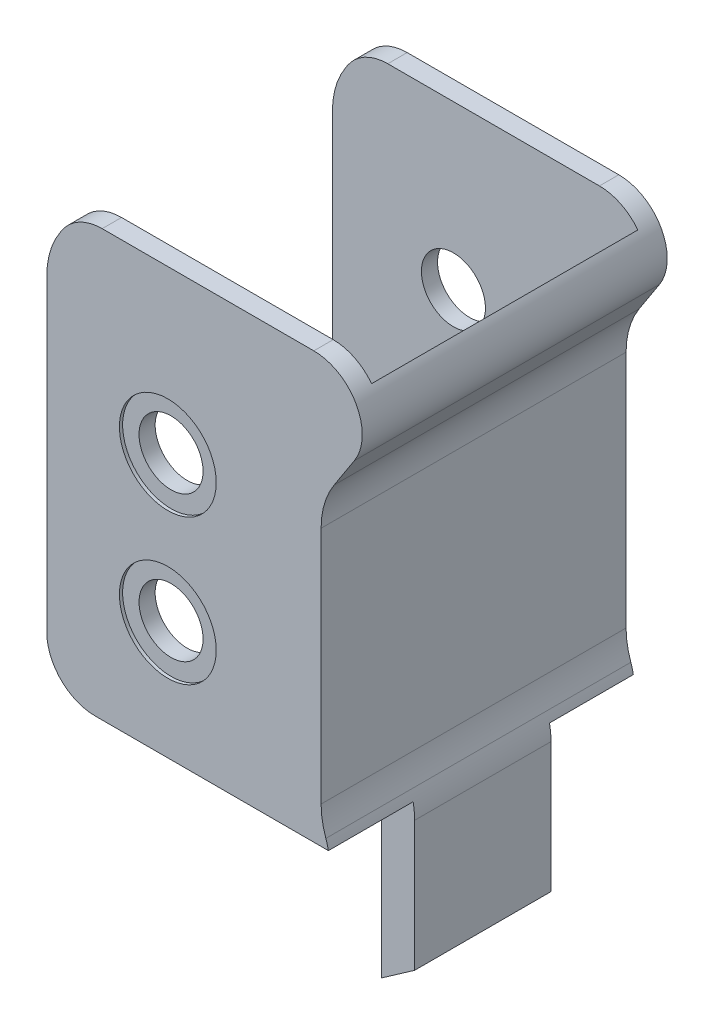
from build123d import *

# Parameters (mm, degrees)
BOSS_EXTRUDE1_START = 2
BOSS_EXTRUDE1_DEPTH = 20.5
CUT_EXTRUDE1_DEPTH  = 8.25
SKETCH4_R           = 1.984375
CUT_EXTRUDE2_DEPTH  = 60.042444086
SKETCH5_R           = 3
CUT_EXTRUDE3_DEPTH  = 1
SKETCH6_R           = 3.444339348
CUT_EXTRUDE4_DEPTH  = 1
FILLET1_R           = 3
SKETCH9_W           = 2.063859561
SKETCH9_H           = 8.45
BOSS_EXTRUDE4_DEPTH = 9
BOSS_EXTRUDE5_DEPTH = 8.45
CUT_EXTRUDE5_DEPTH  = 59.145478277
FILLET3_R           = 3
SKETCH12_W          = 4.417525097
SKETCH12_H          = 36.817204543
CUT_EXTRUDE6_DEPTH  = 58.470832985


with BuildPart() as part:
    # Sketch1 → Boss-Extrude1 (new body)
    with BuildSketch(Plane.XY.offset(BOSS_EXTRUDE1_START)):
        with BuildLine():
            Line((17, 26.68), (17, 41.483303111))
            ThreePointArc((17, 41.483303111), (17.205901326, 42.903379834), (17.80664716, 44.206498286))
            Line((17.80664716, 44.206498286), (22.074645554, 50.778639479))
            Line((22.074645554, 50.778639479), (1.804469576, 50.778639479))
            Line((1.804469576, 50.778639479), (0.80664716, 49.2421277))
            ThreePointArc((0.80664716, 49.2421277), (0.205901326, 47.939009249), (0, 46.518932525))
            Line((0, 46.518932525), (0, 24.405491581))
            Line((0, 24.405491581), (17.547291672, 24.405491581))
            ThreePointArc((17.547291672, 24.405491581), (17.138748019, 25.51028671), (17, 26.68))
        make_face()
    extrude(amount=-BOSS_EXTRUDE1_DEPTH)

    # Sketch2 → Cut-Extrude1 (cut, symmetric)
    with BuildSketch(Plane.XY.offset(-8.25)):
        with BuildLine():
            Line((1.804469576, 50.778639479), (0.80664716, 49.2421277))
            ThreePointArc((0.80664716, 49.2421277), (0.205901326, 47.939009249), (0, 46.518932525))
            Line((0, 46.518932525), (0, 24.405491581))
            Line((0, 24.405491581), (15.483432111, 24.405491581))
            ThreePointArc((15.483432111, 24.405491581), (15.122355105, 25.45104141), (15, 26.550395893))
            Line((15, 26.550395893), (15, 42.075730101))
            ThreePointArc((15, 42.075730101), (15.205901326, 43.495806824), (15.80664716, 44.798925276))
            Line((15.80664716, 44.798925276), (19.689918969, 50.778639479))
            Line((19.689918969, 50.778639479), (1.804469576, 50.778639479))
        make_face()
    extrude(amount=CUT_EXTRUDE1_DEPTH, both=True, mode=Mode.SUBTRACT)

    # Sketch4 → Cut-Extrude2 (cut, through all)
    with BuildSketch(Plane.XY.offset(2)):
        with Locations((7.5, 40.68)):
            Circle(SKETCH4_R)
        with Locations((7.5, 31.68)):
            Circle(SKETCH4_R)
    extrude(amount=-CUT_EXTRUDE2_DEPTH, mode=Mode.SUBTRACT)

    # Sketch5 → Cut-Extrude3 (cut)
    with BuildSketch(Plane.XY.offset(2)):
        with Locations((7.5, 40.68)):
            Circle(SKETCH5_R)
        with Locations((7.5, 31.68)):
            Circle(SKETCH5_R)
    extrude(amount=-CUT_EXTRUDE3_DEPTH, mode=Mode.SUBTRACT)

    # Sketch6 → Cut-Extrude4 (cut)
    with BuildSketch(Plane(origin=(0, 0, -18.5), x_dir=(-1, 0, 0), z_dir=(0, 0, -1))):
        with Locations((-7.5, 40.68)):
            Circle(SKETCH6_R)
        with Locations((-7.5, 31.68)):
            Circle(SKETCH6_R)
    extrude(amount=-CUT_EXTRUDE4_DEPTH, mode=Mode.SUBTRACT)

    # Fillet1
    # the kernel refuses this fillet: 3 mm, written as the material it takes off along each edge
    with BuildSketch(Plane(origin=(22.074645554, 50.778639479, 15.813281645), x_dir=(-0.5446390350150283, -0.8386705679454232, 0), z_dir=(0, 0, -1))) as fillet1_piece_1:
        with BuildLine():
            CenterArc((FILLET1_R * 1.84177088603, FILLET1_R), FILLET1_R, 147, 123)
            Line((FILLET1_R * 1.00310031809, FILLET1_R * 1.54463903502), (0, 0))
            Line((0, 0), (FILLET1_R * 1.84177088603, 0))
        make_face()
    extrude(amount=48.126563291, mode=Mode.SUBTRACT)

    # Sketch9 → Boss-Extrude4 (add)
    with BuildSketch(Plane(origin=(0, 24.405491581, 0), x_dir=(-1, 0, 0), z_dir=(0, -1, 0))):
        with Locations((-16.515361891, 8.275)):
            Rectangle(SKETCH9_W, SKETCH9_H)
    extrude(amount=BOSS_EXTRUDE4_DEPTH)

    # Sketch10 → Boss-Extrude5 (add)
    with BuildSketch(Plane.XY.offset(-4.05)):
        Polygon((15.483432111, 15.405491581), (15.483432111, 13.961434936), (17.547291672, 15.405491581), align=None)
    extrude(amount=-BOSS_EXTRUDE5_DEPTH)

    # Sketch11 → Cut-Extrude5 (cut, through all)
    with BuildSketch(Plane.XY.offset(2)):
        with BuildLine():
            Line((17.264521068, 25.075244788), (17.547291672, 25.075244788))
            Line((17.547291672, 25.075244788), (17.547291672, 23.456711585))
            ThreePointArc((17.547291672, 23.456711585), (17.476067665, 24.278235922), (17.264521068, 25.075244788))
        make_face()
    extrude(amount=-CUT_EXTRUDE5_DEPTH, mode=Mode.SUBTRACT)

    # Fillet3
    fillet3_edges = [part.edges().sort_by_distance(p)[0] for p in [
        (0, 24.405491581, -17.5),
        (1.804469576, 50.778639479, -17.5),
        (1.804469576, 50.778639479, 1),
        (0, 24.405491581, 1),
    ]]
    fillet(fillet3_edges, radius=FILLET3_R)

    # Sketch12 → Cut-Extrude6 (cut, through all)
    with BuildSketch(Plane.ZY):
        with Locations((-19.908762549, 32.370037208)):
            Rectangle(SKETCH12_W, SKETCH12_H)
        with Locations((3.408762549, 32.370037208)):
            Rectangle(SKETCH12_W, SKETCH12_H)
    extrude(amount=-CUT_EXTRUDE6_DEPTH, mode=Mode.SUBTRACT)


solid = part.part
